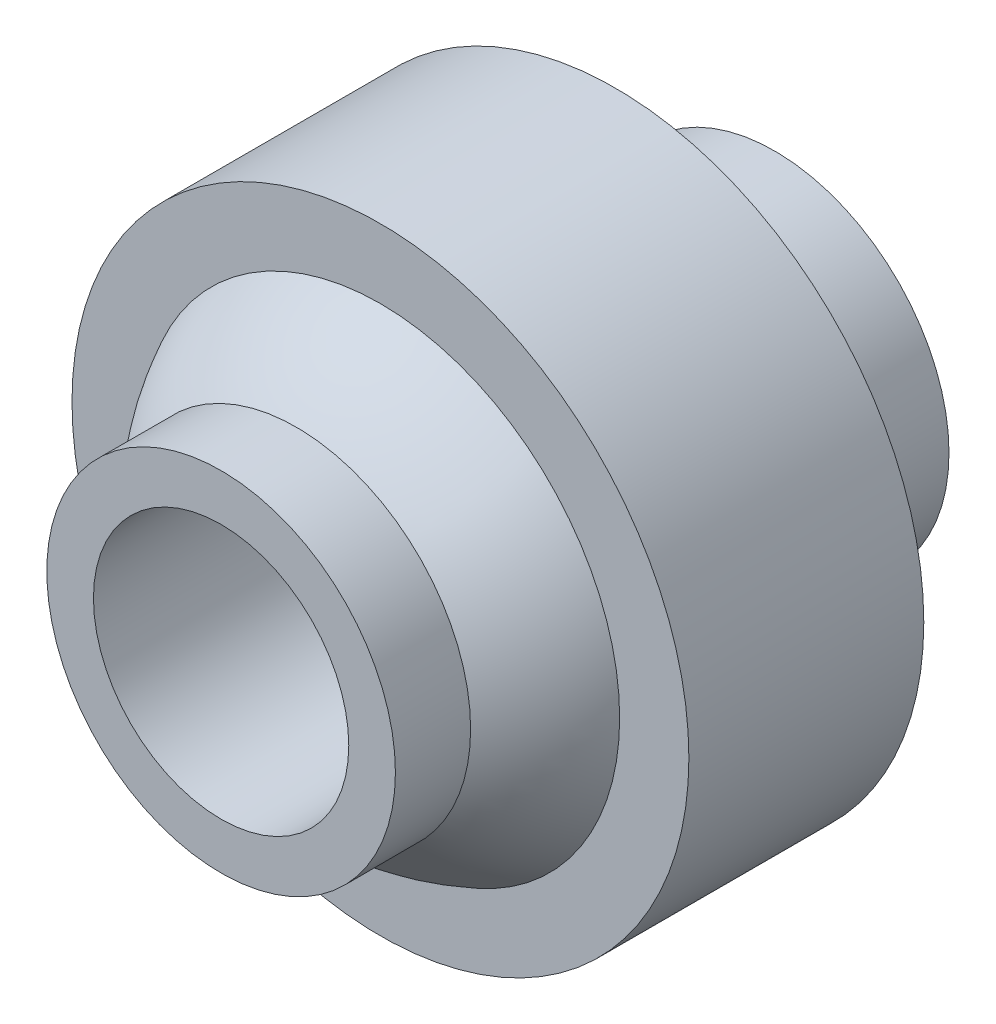
from build123d import *


with BuildPart() as part:
    # Sketch1 → Revolve1 (revolve)
    with BuildSketch(Plane(origin=(0, 0, 0), x_dir=(0, 0, -1), z_dir=(1, 0, 0))):
        with BuildLine():
            Line((-10.3251, -4.7625), (10.3251, -4.7625))
            Line((10.3251, -4.7625), (10.3251, -6.5024))
            Line((10.3251, -6.5024), (7.519993039, -6.5024))
            ThreePointArc((7.519993039, -6.5024), (6.0726569, -7.871107878), (4.3815, -8.923786125))
            Line((4.3815, -8.923786125), (4.3815, -11.5062))
            Line((4.3815, -11.5062), (-4.3815, -11.5062))
            Line((-4.3815, -11.5062), (-4.3815, -8.923786125))
            ThreePointArc((-4.3815, -8.923786125), (-6.0726569, -7.871107878), (-7.519993039, -6.5024))
            Line((-7.519993039, -6.5024), (-10.3251, -6.5024))
            Line((-10.3251, -6.5024), (-10.3251, -4.7625))
        make_face()
    revolve(axis=Axis((0, 0, 0), (0, 0, -1)))


solid = part.part
